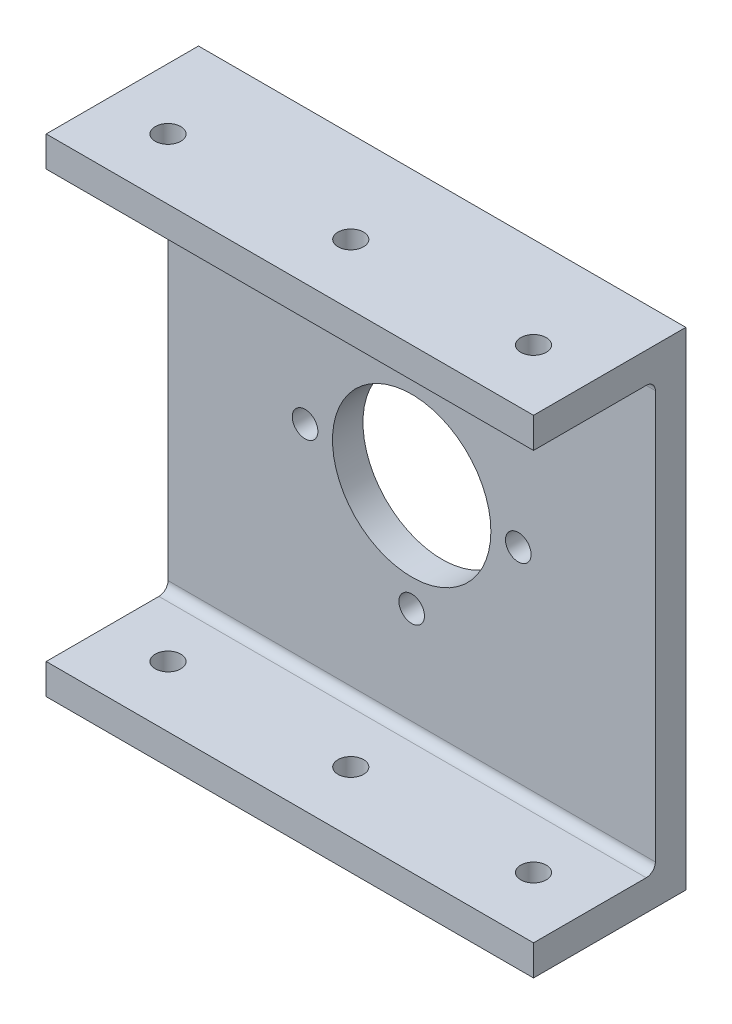
from build123d import *

# Parameters (mm, degrees)
SKETCH_1_W             = 80
SKETCH_1_H             = 80
SKETCH_1_R             = 13
EXTRUDE_1_DEPTH        = 5
SKETCH_2_R             = 2.1
CUT_EXTRUDE_1_DEPTH    = 5
SKETCH_3_W             = 80
SKETCH_3_H             = 20
EXTRUDE_2_DEPTH        = 5
SKETCH_4_R             = 2.1
CUT_EXTRUDE_2_DEPTH    = 5
FILLET_1_R             = 1.5
FILLET_1_OF_MIRROR_1_R = 1.5


with BuildPart() as part:
    # 草图1 → 凸台-拉伸1 (new body)
    with BuildSketch(Plane.XY):
        Rectangle(SKETCH_1_W, SKETCH_1_H)
        Circle(SKETCH_1_R, mode=Mode.SUBTRACT)
    extrude(amount=EXTRUDE_1_DEPTH)

    # 草图2 → 切除-拉伸1 (cut)
    with BuildSketch(Plane.XY.offset(5)):
        with Locations((0, 17.5)):
            Circle(SKETCH_2_R)
        with Locations((17.5, 0)):
            Circle(SKETCH_2_R)
        with Locations((-17.5, 0)):
            Circle(SKETCH_2_R)
        with Locations((0, -17.5)):
            Circle(SKETCH_2_R)
    extrude(amount=-CUT_EXTRUDE_1_DEPTH, mode=Mode.SUBTRACT)

    # 草图3 → 凸台-拉伸2 (add)
    with BuildSketch(Plane(origin=(0, 40, 0), x_dir=(1, 0, 0), z_dir=(0, 1, 0))):
        with Locations((0, -15)):
            Rectangle(SKETCH_3_W, SKETCH_3_H)
    extrude_2 = extrude(amount=-EXTRUDE_2_DEPTH)

    # 草图4 → 切除-拉伸2 (cut)
    with BuildSketch(Plane(origin=(0, 40, 0), x_dir=(1, 0, 0), z_dir=(0, 1, 0))):
        with Locations((-30, -15)):
            Circle(SKETCH_4_R)
        with Locations((0, -15)):
            Circle(SKETCH_4_R)
        with Locations((30, -15)):
            Circle(SKETCH_4_R)
    cut_extrude_2 = extrude(amount=-CUT_EXTRUDE_2_DEPTH, mode=Mode.SUBTRACT)

    # 圆角1
    fillet_1_edges = [part.edges().sort_by_distance(p)[0] for p in [
        (0, 35, 5),
    ]]
    fillet(fillet_1_edges, radius=FILLET_1_R)

    # 镜向1: 凸台-拉伸2, 切除-拉伸2 across plane
    add(extrude_2.mirror(Plane.ZX))
    add(cut_extrude_2.mirror(Plane.ZX), mode=Mode.SUBTRACT)

    # 圆角1 of 镜向1
    fillet_1_of_mirror_1_edges = [part.edges().sort_by_distance(p)[0] for p in [
        (0, -35, 5),
    ]]
    fillet(fillet_1_of_mirror_1_edges, radius=FILLET_1_OF_MIRROR_1_R)


solid = part.part
